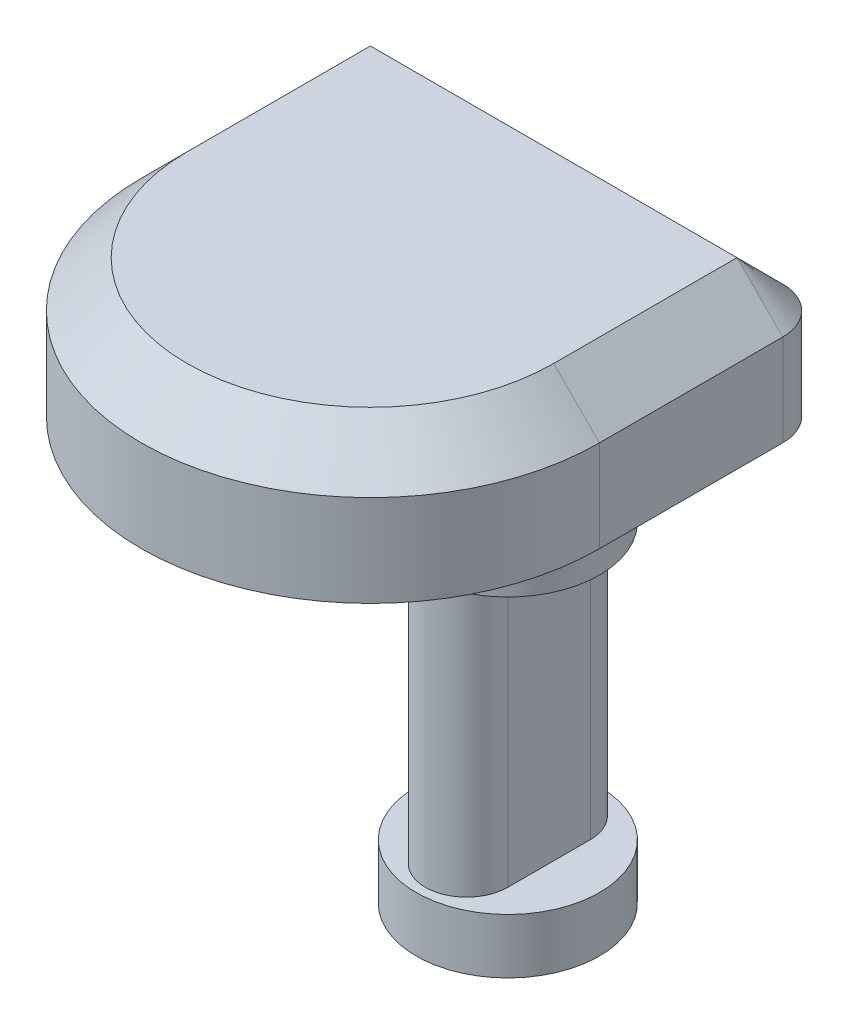
from build123d import *

# Parameters (mm, degrees)
EXTRUDE_1_DEPTH      = 8
SKETCH_2_R           = 2
EXTRUDE_2_DEPTH      = 1
EXTRUDE_3_DEPTH      = 0.2
EXTRUDE_3_DEPTH_BACK = 1
SKETCH_3_R           = 2
EXTRUDE_4_DEPTH      = 2.5
EXTRUDE_5_DEPTH      = 3
CHAMFER_1_SIZE       = 1
CUT_EXTRUDE_1_DEPTH  = 0.2


with BuildPart() as part:
    # 草图1 → 凸台-拉伸1 (new body)
    with BuildSketch(Plane(origin=(0, 0, 0), x_dir=(1, 0, 0), z_dir=(0, 1, 0))):
        with BuildLine():
            Line((0.9, 0.9), (0.9, -0.9))
            ThreePointArc((0.9, -0.9), (0, -1.8), (-0.9, -0.9))
            Line((-0.9, -0.9), (-0.9, 0.9))
            ThreePointArc((-0.9, 0.9), (0, 1.8), (0.9, 0.9))
        make_face()
    extrude(amount=EXTRUDE_1_DEPTH)

    # 草图2 → 凸台-拉伸2 (add)
    with BuildSketch(Plane(origin=(0, 8, 0), x_dir=(1, 0, 0), z_dir=(0, 1, 0))):
        with Locations(Location((0, 0, 0), (0, 0, 270))):
            Circle(SKETCH_2_R)
    extrude(amount=-EXTRUDE_2_DEPTH)

    # 草图3 → 凸台-拉伸3 (add, two sides: drawn at the far end of the back side and taken through both)
    with BuildSketch(Plane.XZ.offset(-EXTRUDE_3_DEPTH_BACK)):
        with Locations(Location((0, 0, 0), (0, 0, 90))):
            Circle(SKETCH_3_R)
    extrude(amount=EXTRUDE_3_DEPTH + EXTRUDE_3_DEPTH_BACK)

    # 草图6 → 凸台-拉伸4 (add)
    with BuildSketch(Plane(origin=(0, 8, 0), x_dir=(1, 0, 0), z_dir=(0, 1, 0))):
        with BuildLine():
            Line((-0.9, -0.9), (-0.9, 0.9))
            ThreePointArc((-0.9, 0.9), (0, 1.8), (0.9, 0.9))
            Line((0.9, 0.9), (0.9, -0.9))
            ThreePointArc((0.9, -0.9), (0, -1.8), (-0.9, -0.9))
        make_face()
    extrude(amount=EXTRUDE_4_DEPTH)

    # 草图7 → 凸台-拉伸5 (add)
    with BuildSketch(Plane(origin=(0, 10.5, 0), x_dir=(1, 0, 0), z_dir=(0, 1, 0))):
        with BuildLine():
            Line((-5, -3), (-5, 1))
            ThreePointArc((-5, 1), (-4.707106781, 1.707106781), (-4, 2))
            Line((-4, 2), (4, 2))
            ThreePointArc((4, 2), (4.707106781, 1.707106781), (5, 1))
            Line((5, 1), (5, -3))
            ThreePointArc((5, -3), (0, -8), (-5, -3))
        make_face()
    extrude(amount=EXTRUDE_5_DEPTH)

    # 倒角1
    chamfer_1_edges = [part.edges().sort_by_distance(p)[0] for p in [
        (4.707106781, 13.5, -1.707106781),
        (0, 13.5, -2),
        (-4.707106781, 13.5, -1.707106781),
        (-5, 13.5, 1),
        (0, 13.5, 8),
        (5, 13.5, 1),
    ]]
    chamfer(chamfer_1_edges, length=CHAMFER_1_SIZE - 0.0001)  # a hair under: the kernel refuses the full size

    # 草图8 → 切除-拉伸1 (cut)
    with BuildSketch(Plane.XZ.offset(0.2)):
        with BuildLine():
            Line((-0.4, 1.2), (0.4, 1.2))
            ThreePointArc((0.4, 1.2), (1.6, 0), (0.4, -1.2))
            Line((0.4, -1.2), (-0.4, -1.2))
            ThreePointArc((-0.4, -1.2), (-1.6, 0), (-0.4, 1.2))
        make_face()
    extrude(amount=-CUT_EXTRUDE_1_DEPTH, mode=Mode.SUBTRACT)


solid = part.part
